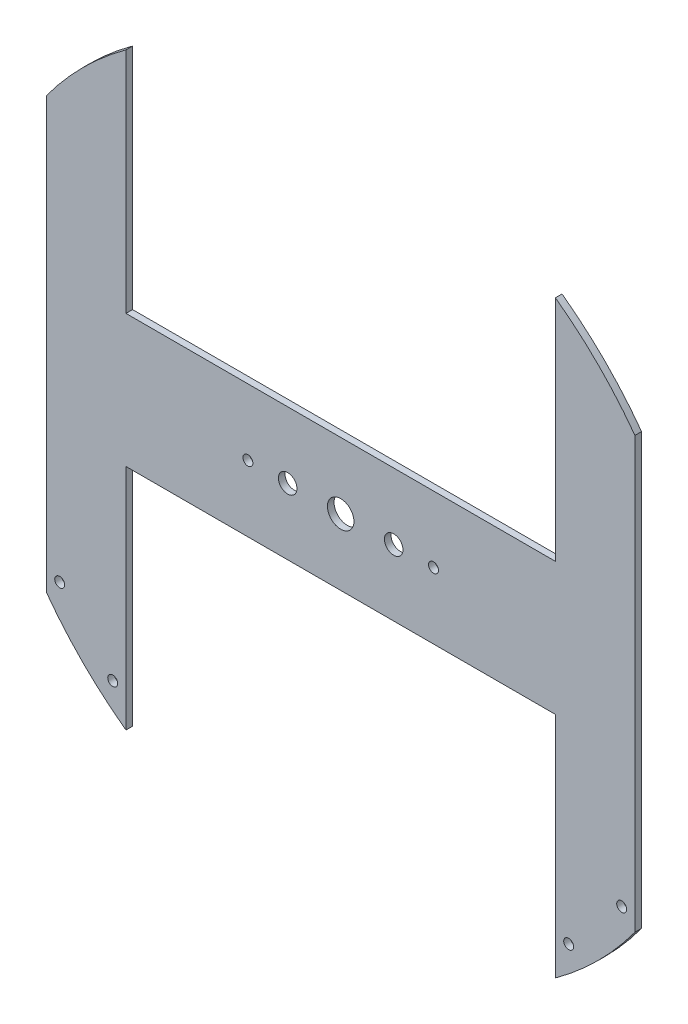
from build123d import *

# Parameters (mm, degrees)
SKETCH1_R               = 2.38125
SKETCH1_R_2             = 4.445
BOSS_EXTRUDE1_DEPTH     = 3.175
BOSS_EXTRUDE2_DEPTH     = 50.8
CUT_EXTRUDE1_DEPTH      = 209.526843615
CUT_EXTRUDE1_DEPTH_BACK = 209.526843615
SKETCH3_R               = 203.829254644
SKETCH3_R_2             = 174.625
SKETCH4_R               = 6.35
CUT_EXTRUDE2_DEPTH      = 200.484174204
SKETCH5_R               = 2.38125
CUT_EXTRUDE3_DEPTH      = 200.484174204


with BuildPart() as part:
    # Sketch1 → Boss-Extrude1 (new body)
    with BuildSketch(Plane.XY):
        with BuildLine():
            Line((-102.865544724, 31.75), (-102.865544724, 145.022480011))
            ThreePointArc((-102.865544724, 145.022480011), (-123.286100966, 128.114703717), (-140.965544724, 108.358456987))
            Line((-140.965544724, 108.358456987), (-140.965544724, -108.358456987))
            ThreePointArc((-140.965544724, -108.358456987), (-123.286100966, -128.114703717), (-102.865544724, -145.022480011))
            Line((-102.865544724, -145.022480011), (-102.865544724, -31.75))
            Line((-102.865544724, -31.75), (102.865544724, -31.75))
            Line((102.865544724, -31.75), (102.865544724, -145.022480011))
            ThreePointArc((102.865544724, -145.022480011), (123.286100966, -128.114703717), (140.965544724, -108.358456987))
            Line((140.965544724, -108.358456987), (140.965544724, 108.358456987))
            ThreePointArc((140.965544724, 108.358456987), (123.286100966, 128.114703717), (102.865544724, 145.022480011))
            Line((102.865544724, 145.022480011), (102.865544724, 31.75))
            Line((102.865544724, 31.75), (-102.865544724, 31.75))
        make_face()
        with Locations((44.45, 0)):
            Circle(SKETCH1_R, mode=Mode.SUBTRACT)
        with Locations((-44.45, 0)):
            Circle(SKETCH1_R, mode=Mode.SUBTRACT)
        with Locations((-25.4, 0)):
            Circle(SKETCH1_R_2, mode=Mode.SUBTRACT)
        with Locations((25.4, 0)):
            Circle(SKETCH1_R_2, mode=Mode.SUBTRACT)
    extrude(amount=BOSS_EXTRUDE1_DEPTH)

    # Sketch2 → Boss-Extrude2 (add)
    with BuildSketch(Plane.XY.offset(3.175)):
        with BuildLine():
            ThreePointArc((-102.865544724, -141.111907129), (-123.390730215, -123.566250741), (-140.965544724, -103.066026535))
            Line((-140.965544724, -103.066026535), (-140.965544724, -108.358456987))
            ThreePointArc((-140.965544724, -108.358456987), (-123.286100966, -128.114703717), (-102.865544724, -145.022480011))
            Line((-102.865544724, -145.022480011), (-102.865544724, -141.111907129))
        make_face()
        with BuildLine():
            ThreePointArc((140.965544724, -103.066026535), (123.390730215, -123.566250741), (102.865544724, -141.111907129))
            Line((102.865544724, -141.111907129), (102.865544724, -145.022480011))
            ThreePointArc((102.865544724, -145.022480011), (123.286100966, -128.114703717), (140.965544724, -108.358456987))
            Line((140.965544724, -108.358456987), (140.965544724, -103.066026535))
        make_face()
    extrude(amount=BOSS_EXTRUDE2_DEPTH)

    # Sketch3 → Cut-Extrude1 (cut, two sides: drawn at the far end of the back side and taken through both)
    with BuildSketch(Plane.XY.offset(3.175).offset(-CUT_EXTRUDE1_DEPTH_BACK)):
        Circle(SKETCH3_R)
        Circle(SKETCH3_R_2, mode=Mode.SUBTRACT)
    extrude(amount=CUT_EXTRUDE1_DEPTH + CUT_EXTRUDE1_DEPTH_BACK, mode=Mode.SUBTRACT)

    # Sketch4 → Cut-Extrude2 (cut, through all)
    with BuildSketch(Plane.XY.offset(3.175)):
        Circle(SKETCH4_R)
    extrude(amount=-CUT_EXTRUDE2_DEPTH, mode=Mode.SUBTRACT)

    # Sketch5 → Cut-Extrude3 (cut, through all)
    with BuildSketch(Plane.XY.offset(3.175)):
        with Locations((134.615544724, -95.585904393)):
            Circle(SKETCH5_R)
        with Locations((109.215544724, -123.814275391)):
            Circle(SKETCH5_R)
        with Locations((-134.615544724, -95.585904393)):
            Circle(SKETCH5_R)
        with Locations((-109.215544724, -123.814275391)):
            Circle(SKETCH5_R)
    extrude(amount=-CUT_EXTRUDE3_DEPTH, mode=Mode.SUBTRACT)


solid = part.part
